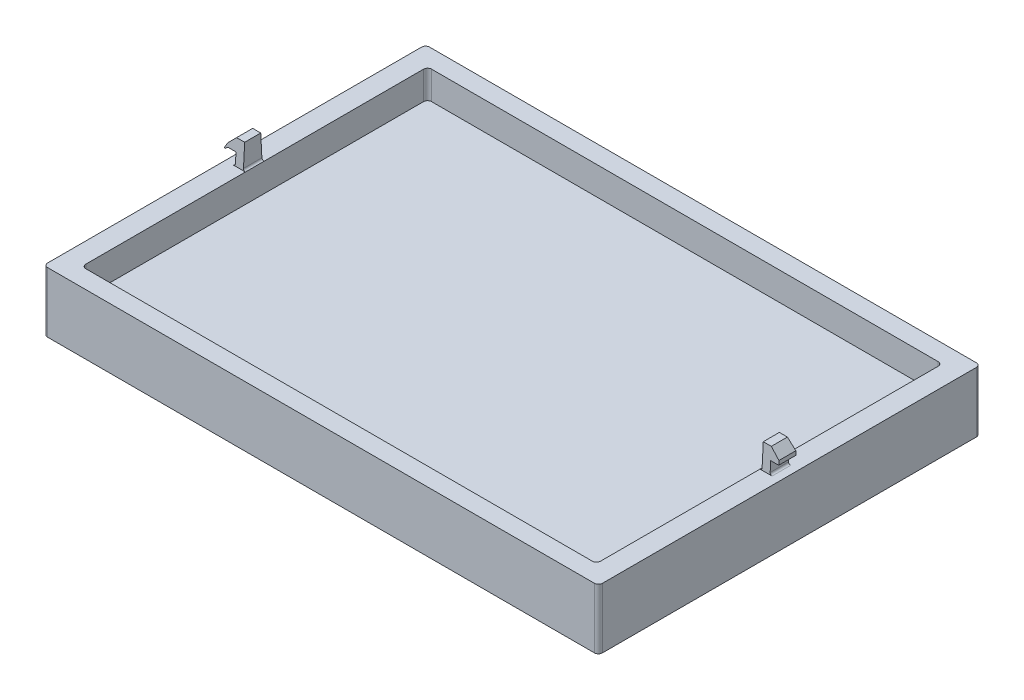
from build123d import *

# Parameters (mm, degrees)
SKETCH1_W           = 138
SKETCH1_H           = 95
BOSS_EXTRUDE1_DEPTH = 15
SKETCH2_W           = 128
SKETCH2_H           = 86
CUT_EXTRUDE1_DEPTH  = 7
SNAP_START          = 64.5
SNAP_HOOK2_DEPTH    = 2
SNAP_HOOK2_2_DEPTH  = 2
FILLET1_R           = 1
FILLET2_R           = 0.5
BOSS_EXTRUDE2_DEPTH = 2
FILLET3_R           = 0.5
FILLET4_R           = 0.5
FILLET7_R           = 0.1


with BuildPart() as part:
    # Sketch1 → Boss-Extrude1 (new body)
    with BuildSketch(Plane(origin=(0, 0, 0), x_dir=(1, 0, 0), z_dir=(0, 1, 0))):
        Rectangle(SKETCH1_W, SKETCH1_H)
    extrude(amount=BOSS_EXTRUDE1_DEPTH)

    # Sketch2 → Cut-Extrude1 (cut)
    with BuildSketch(Plane(origin=(0, 15, 0), x_dir=(1, 0, 0), z_dir=(0, 1, 0))):
        Rectangle(SKETCH2_W, SKETCH2_H)
    extrude(amount=-CUT_EXTRUDE1_DEPTH, mode=Mode.SUBTRACT)



with BuildPart() as body_2:
    # Snap Hook2: read off the stored shape, not the designer's step
    # Snap Hook2 outline → Snap Hook2 (new body)
    with BuildSketch(Plane.YZ.offset(SNAP_START)):
        Polygon((21, -2), (21, 2), (18, 2.157223338), (18, -2.157223338), align=None)
    snap_hook2 = extrude(amount=SNAP_HOOK2_DEPTH)


with BuildPart() as part_1:
    add(part.part)

    add(body_2.part)  # Snap Hook2 2 merges body 2
    # Snap Hook2 2 outline → Snap Hook2 2 (add)
    with BuildSketch(Plane.YZ.offset(SNAP_START)):
        Polygon((18, -2.157223338), (18, 2.157223338), (15, 2.314446676), (15, -2.314446676), align=None)
    snap_hook2_2 = extrude(amount=SNAP_HOOK2_2_DEPTH)

    # Snap Hook2 3: loft between two sections, ruled curve by curve
    snap_hook2_3_from = [
        Edge.make_line((66.5, 21, -2), (66.5, 21, 2)),
        Edge.make_line((66.5, 18, 2.157223338), (66.5, 18, -2.157223338)),
        Edge.make_line((66.5, 18, 2.157223338), (66.5, 21, 2)),
        Edge.make_line((66.5, 18, -2.157223338), (66.5, 21, -2)),
    ]
    snap_hook2_3_to = [
        Edge.make_line((68.5, 19, -2.104815559), (68.5, 19, 2.104815559)),
        Edge.make_line((68.5, 18, 2.157223338), (68.5, 18, -2.157223338)),
        Edge.make_line((68.5, 18, 2.157223338), (68.5, 19, 2.104815559)),
        Edge.make_line((68.5, 18, -2.157223338), (68.5, 19, -2.104815559)),
    ]
    snap_hook2_3 = Solid(Shell([*[Face.make_surface_from_curves(snap_hook2_3_from[k], snap_hook2_3_to[k]) for k in range(4)], Face(Wire(snap_hook2_3_from)), Face(Wire(snap_hook2_3_to))]))
    add(snap_hook2_3)

    # Fillet1
    fillet1_edges = [part_1.edges().sort_by_distance(p)[0] for p in [
        (64, 11.5, -43),
        (64, 11.5, 43),
        (-64, 11.5, 43),
        (-64, 11.5, -43),
        (-69, 7.5, -47.5),
        (69, 7.5, -47.5),
        (69, 7.5, 47.5),
        (-69, 7.5, 47.5),
    ]]
    fillet(fillet1_edges, radius=FILLET1_R)

    # Mirror1: Snap Hook2, Snap Hook2 2, Snap Hook2 3 across plane
    add(snap_hook2.mirror(Plane(origin=(0, 0, 0), x_dir=(0, 0, 1), z_dir=(1, 0, 0))))
    add(snap_hook2_2.mirror(Plane(origin=(0, 0, 0), x_dir=(0, 0, 1), z_dir=(1, 0, 0))))
    add(snap_hook2_3.mirror(Plane(origin=(0, 0, 0), x_dir=(0, 0, 1), z_dir=(1, 0, 0))))

    # Fillet2
    fillet2_edges = [part_1.edges().sort_by_distance(p)[0] for p in [
        (66.5, 15, 0),
        (64.5, 15, 0),
        (-66.5, 15, 0),
        (-64.5, 15, 0),
    ]]
    fillet(fillet2_edges, radius=FILLET2_R - 0.0001)  # a hair under: the kernel refuses the full size

    # Sketch5 → Boss-Extrude2 (add)
    with BuildSketch(Plane.ZY.offset(68.5)):
        Polygon((-2.104815559, 19), (2.104815559, 19), (2.189499682, 17.384130663), (-2.189499682, 17.384130663), align=None)
    extrude(amount=BOSS_EXTRUDE2_DEPTH)

    # Cut-Sweep1: sweep along a curve in space
    with BuildLine() as cut_sweep1_path:
        Line((-70.5, 17.384130663, -2.189499682), (-70.5, 17.384130663, 2.189499682))
    # Sketch6 → Cut-Sweep1 (sweep, cut)
    with BuildSketch(Plane(origin=(0, 0.162048562, -3.09207076), x_dir=(-1, 0, 0), z_dir=(0, 0.052335956242943814, -0.998629534754574))):
        Polygon((68.5, 17.862431279), (69.245478091, 17.245716756), (68.5, 17.245716756), align=None)
    sweep(path=cut_sweep1_path.line, mode=Mode.SUBTRACT)

    # Cut-Sweep2: sweep along a curve in space
    with BuildLine() as cut_sweep2_path:
        Line((-70.5, 17.384130663, -2.189499682), (-70.5, 17.384130663, 2.189499682))
    # Sketch7 → Cut-Sweep2 (sweep, cut)
    with BuildSketch(Plane(origin=(0, 0.162048562, -3.09207076), x_dir=(-1, 0, 0), z_dir=(0, 0.052335956242943814, -0.998629534754574))):
        Polygon((68.5, 18.863803625), (69.5, 17.245716756), (70.5, 17.245716756), (70.5, 18.863803625), align=None)
    sweep(path=cut_sweep2_path.line, mode=Mode.SUBTRACT)

    # Fillet3
    # the kernel refuses this fillet: 0.5 mm, written as the material it adds along each edge
    with BuildSketch(Plane(origin=(-68.5, 18, 2.606776404), x_dir=(1, 0, 0), z_dir=(0, 0, -1))) as fillet3_piece_1_section:
        with BuildLine():
            CenterArc((FILLET3_R * 0.359642452732, FILLET3_R), FILLET3_R, 230.43852258, 39.56147742)
            Line((-FILLET3_R * 0.277263341593, FILLET3_R * 0.22905836203), (0, 0))
            Line((0, 0), (FILLET3_R * 0.359642452732, 0))
        make_face()
    fillet3_piece_1 = extrude(amount=5.213552808, mode=Mode.PRIVATE)
    fillet3_piece_1 = split(fillet3_piece_1, bisect_by=Plane(origin=(-68.5, 17.976504454, 2.158454687), z_dir=(0, -0.052335956242943654, -0.9986295347545739)), keep=Keep.TOP, mode=Mode.PRIVATE)
    fillet3_piece_1 = split(fillet3_piece_1, bisect_by=Plane(origin=(-68.5, 18.248986786, -2.144174493), z_dir=(0, -0.05233595624294393, 0.9986295347545739)), keep=Keep.TOP, mode=Mode.PRIVATE)
    add(fillet3_piece_1)
    # the kernel refuses this fillet: 0.5 mm, written as the material it takes off along each edge
    with BuildSketch(Plane(origin=(-68.5, 19, -2.249978478), x_dir=(0.7071067811865781, 0.7071067811865169, 0), z_dir=(0, 0, 1))) as fillet3_2_piece_1:
        with BuildLine():
            CenterArc((FILLET3_R * 0.11613033532, -FILLET3_R), FILLET3_R, 90, 13.248212602)
            Line((-FILLET3_R * 0.11303968997, -FILLET3_R * 0.0266135918822), (0, 0))
            Line((0, 0), (FILLET3_R * 0.11613033532, 0))
        make_face()
    extrude(amount=4.499956956, mode=Mode.SUBTRACT)

    # Fillet4
    # the kernel refuses this fillet: 0.5 mm, written as the material it takes off along each edge
    with BuildSketch(Plane(origin=(-69.5, 17.384130663, -3.553874189), x_dir=(0.5262404509675064, 0.8503358088223238, 0), z_dir=(0, 0, 1))) as fillet4_piece_1:
        with BuildLine():
            CenterArc((0.545749803, -0.5), FILLET4_R, 90, 55.448844763)
            Line((0.133939724, -0.216429093), (0.125703523, -0.210757675))
            ThreePointArc((0.125703523, -0.210757675), (0.058466504, -0.113476951), (-0.008503358, -0.005262405))
            Line((-0.008503358, -0.005262405), (0, 0.01))
            Line((0, 0.01), (0.545749803, 0.01))
            Line((0.545749803, 0.01), (0.545749803, 0))
        make_face()
    extrude(amount=7.107748378, mode=Mode.SUBTRACT)

    # Fillet7
    fillet7_edges = [part_1.edges().sort_by_distance(p)[0] for p in [
        (-69.245478091, 17.384130663, 0),
    ]]
    fillet(fillet7_edges, radius=FILLET7_R)


solid = part_1.part
